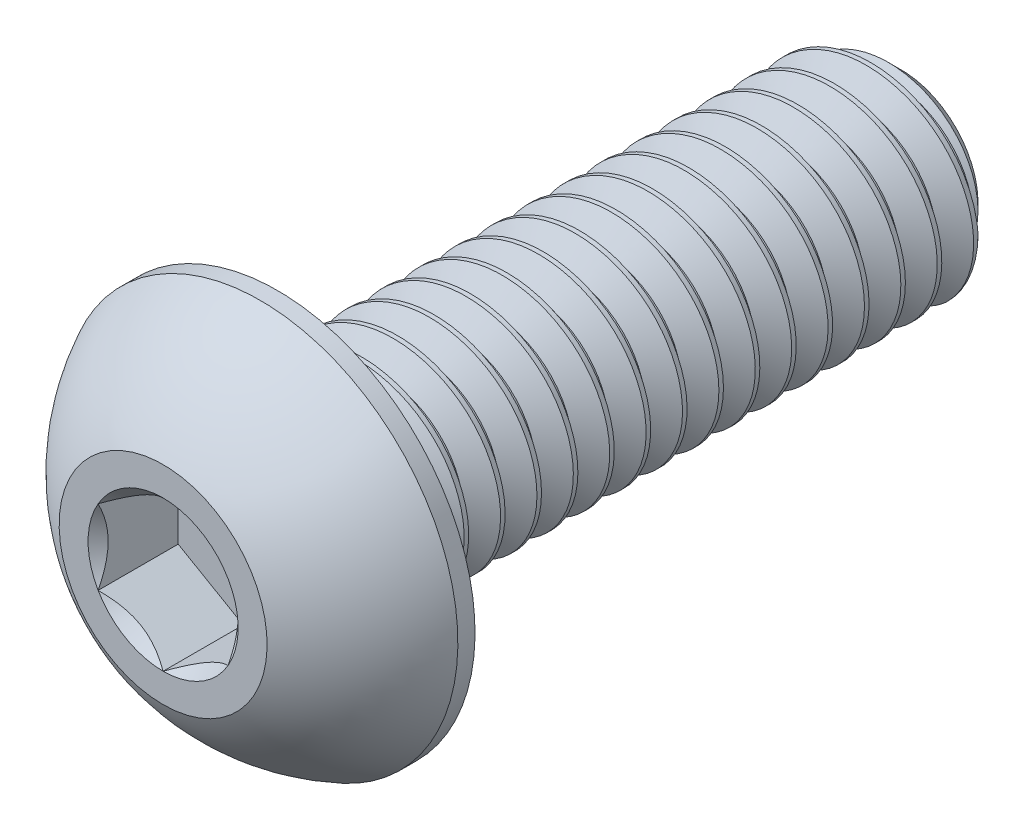
from build123d import *

# Parameters (mm, degrees)
CUT_EXTRUDE2_DEPTH = 1.54
CUT_SWEEP2_PITCH   = 0.7
CUT_SWEEP2_TO      = 12


with BuildPart() as part:
    # Sketch10 → Revolve3 (revolve)
    with BuildSketch(Plane(origin=(0, 0, 0), x_dir=(0, 0, -1), z_dir=(1, 0, 0)), mode=Mode.PRIVATE) as revolve3_sk:
        Polygon((5.475, 2), (6, 1.475), (6, 0), (-6, 0), (-6, 2), align=None)
    revolve(revolve3_sk.sketch.rotate(Axis((0, 0, 8.2), (0, 0, -1)), 180), axis=Axis((0, 0, 8.2), (0, 0, -1)))

    # Sketch7 → Revolve2 (revolve)
    with BuildSketch(Plane(origin=(0, 0, 0), x_dir=(0, 0, -1), z_dir=(1, 0, 0)), mode=Mode.PRIVATE) as revolve2_sk:
        with BuildLine():
            Line((-6.33, 3.8), (-6, 3.8))
            Line((-6, 3.8), (-6, 0))
            Line((-6, 0), (-8.2, 0))
            Line((-8.2, 0), (-8.2, 2))
            ThreePointArc((-8.2, 2), (-7.406499853, 3.047002626), (-6.33, 3.8))
        make_face()
    revolve(revolve2_sk.sketch.rotate(Axis((0, 0, 8.2), (0, 0, -1)), 180), axis=Axis((0, 0, 8.2), (0, 0, -1)))

    # Sketch5 → Cut-Extrude2 (cut)
    with BuildSketch(Plane.XY.offset(8.2)):
        Polygon((1.25, -0.721687836), (1.25, 0.721687836), (0, 1.443375673), (-1.25, 0.721687836), (-1.25, -0.721687836), (0, -1.443375673), align=None)
    extrude(amount=-CUT_EXTRUDE2_DEPTH, mode=Mode.SUBTRACT)

    # Cut-Extrude3 cone 1 section (through the dimple's axis) → Cut-Extrude3 (revolve, cut)
    with BuildSketch(Plane(origin=(0, 0, 8.2), x_dir=(0, -1, 0), z_dir=(1, 0, 0))):
        Polygon((0, 0), (1.443375673, 0), (0, 1.443375673), align=None)
    revolve(axis=Axis((0, 0, 8.2), (0, 0, -1)), mode=Mode.SUBTRACT)


with BuildPart() as body_2:
    # Split1: read off the stored shape, not the designer's step
    # Split1: the piece on the far side of the plane
    add(part.part)
    split(bisect_by=Plane.XY.offset(6), keep=Keep.BOTTOM)

    # Cut-Sweep2: arcs per turn and ends read off the stored shape
    # Cut-Sweep2: the profile of Sketch12 screwed along a right-hand helix through 22 turns, 6 arcs to a turn; built about Z, then put on its axis
    cut_sweep2_z = Axis((0, 0, 0), (0, 0, 1))
    cut_sweep2_corners = [(1.545336663, 0, -0.2625), (1.545336663, 0, -0.35), (2.037888611, 0, -0.634375), (2.037888611, 0, 0.021875)]
    with BuildLine(mode=Mode.PRIVATE) as cut_sweep2_profile:
        Line(cut_sweep2_corners[0], cut_sweep2_corners[1])
        Line(cut_sweep2_corners[1], cut_sweep2_corners[2])
        Line(cut_sweep2_corners[2], cut_sweep2_corners[3])
        Line(cut_sweep2_corners[3], cut_sweep2_corners[0])
    cut_sweep2_cap = Face(cut_sweep2_profile.wire())
    cut_sweep2_turn_angles = [0, 30, 60, 90, 120, 150, 180, 210, 240, 270, 300, 330, 360]
    cut_sweep2_turn_weights = [1, 0.8660254037844387, 1, 0.8660254037844387, 1, 0.8660254037844387, 1, 0.8660254037844387, 1, 0.8660254037844387, 1, 0.8660254037844387, 1]
    cut_sweep2_turn_rails = [Edge.make_bspline([Vector(p[0], p[1], 0).rotate(cut_sweep2_z, cut_sweep2_turn_angles[k]) / cut_sweep2_turn_weights[k] + Vector(0, 0, p[2] + CUT_SWEEP2_PITCH * cut_sweep2_turn_angles[k] / 360) for k in range(13)], [0, 0, 0, 1, 1, 2, 2, 3, 3, 4, 4, 5, 5, 6, 6, 6], 2, cut_sweep2_turn_weights) for p in cut_sweep2_corners]
    cut_sweep2_turn_sides = [Face.make_surface_from_curves(cut_sweep2_turn_rails[p[0]], cut_sweep2_turn_rails[p[1]]) for p in [(0, 1), (1, 2), (2, 3), (3, 0)]]
    cut_sweep2 = Plane(origin=(0, 0, -6), x_dir=(0, 1, 0), z_dir=(0, 0, 1)) * split(Solid(Shell([*[p.moved(Location((0, 0, CUT_SWEEP2_PITCH * i))) for i in range(22) for p in cut_sweep2_turn_sides], cut_sweep2_cap, cut_sweep2_cap.rotate(cut_sweep2_z, 7920).moved(Location((0, 0, CUT_SWEEP2_PITCH * 7920 / 360)))])), bisect_by=Plane.XY.offset(CUT_SWEEP2_TO), keep=Keep.BOTTOM, mode=Mode.PRIVATE)
    add(cut_sweep2, mode=Mode.SUBTRACT)


with BuildPart() as part_1:
    add(part.part)

    # Split1
    split(bisect_by=Plane.XY.offset(6), keep=Keep.TOP)

    add(body_2.part)  # Boss-Extrude1 merges body 2
    # Boss-Extrude1 cone 1 section (through the dimple's axis) → Boss-Extrude1 (revolve)
    with BuildSketch(Plane(origin=(0, 0, 6), x_dir=(0, -1, 0), z_dir=(1, 0, 0))):
        Polygon((0, 0), (2, 0), (0, 2), align=None)
    revolve(axis=Axis((0, 0, 6), (0, 0, -1)))


solid = part_1.part
